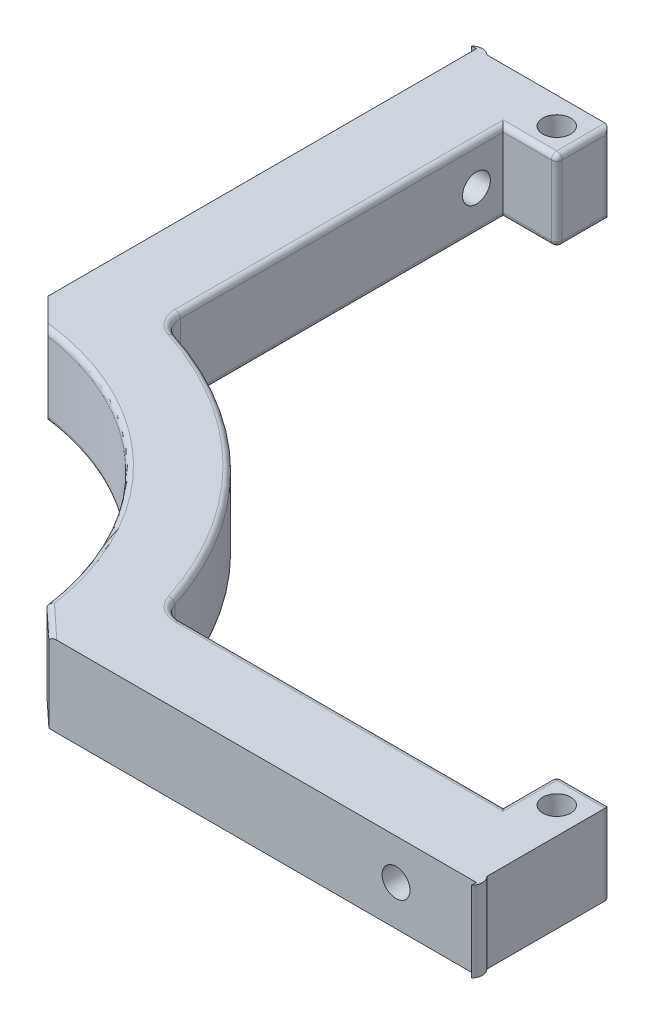
from build123d import *

# Parameters (mm, degrees)
SKETCH1_R           = 3.302
BOSS_EXTRUDE1_DEPTH = 19.05
CHAMFER1_SIZE       = 6.593417442
CHAMFER1_SIZE_2     = 6.35
FILLET1_R           = 5.08
FILLET2_R           = 1.27
CUT_EXTRUDE3_REACH  = 234.345
SKETCH4_R           = 3.302
CUT_EXTRUDE4_REACH  = 235.383
SKETCH5_R           = 3.302
FILLET27_R          = 2.54


with BuildPart() as part:
    # Sketch1 → Boss-Extrude1 (new body)
    with BuildSketch(Plane(origin=(0, 0, 0), x_dir=(1, 0, 0), z_dir=(0, 1, 0))):
        with BuildLine():
            Line((0, 0), (0, -107.95))
            ThreePointArc((0, -107.95), (44.047088178, -127.137896363), (63.234984541, -171.184984541))
            Line((63.234984541, -171.184984541), (171.184984541, -171.184984541))
            Line((171.184984541, -171.184984541), (171.184984541, -172.327984541))
            Line((171.184984541, -172.327984541), (173.724984541, -172.327984541))
            Line((173.724984541, -172.327984541), (171.184984541, -168.644984541))
            Line((171.184984541, -168.644984541), (171.184984541, -139.434984541))
            Line((171.184984541, -139.434984541), (158.484984541, -139.434984541))
            Line((158.484984541, -139.434984541), (158.484984541, -152.134984541))
            Line((158.484984541, -152.134984541), (78.172986392, -152.134984541))
            ThreePointArc((78.172986392, -152.134984541), (56.455029962, -114.729954579), (19.05, -93.011998149))
            Line((19.05, -93.011998149), (19.05, -12.7))
            Line((19.05, -12.7), (31.75, -12.7))
            Line((31.75, -12.7), (31.75, 0))
            Line((31.75, 0), (2.54, 0))
            Line((2.54, 0), (-1.143, 2.54))
            Line((-1.143, 2.54), (-1.143, 0))
            Line((-1.143, 0), (0, 0))
        make_face()
        with Locations(Location((25.4, -6.35, 0), (0, 0, 90))):
            Circle(SKETCH1_R, mode=Mode.SUBTRACT)
        with Locations(Location((164.834984541, -145.784984541, 0), (0, 0, 90))):
            Circle(SKETCH1_R, mode=Mode.SUBTRACT)
    extrude(amount=BOSS_EXTRUDE1_DEPTH)

    # Chamfer1
    # the kernel refuses this chamfer: 6.593417442, 6.35 mm, written as the material it takes off along each edge
    with BuildSketch(Plane(origin=(63.234984541, -17.246656522, 171.184984541), x_dir=(-0.08720585159632499, 0, -0.9961903128656491), z_dir=(0, 1, 0))) as chamfer1_piece_1:
        with BuildLine():
            Line((6.700635555, 0), (-CHAMFER1_SIZE * 0.0872058515927, -CHAMFER1_SIZE * 0.996190312824))
            Line((-CHAMFER1_SIZE * 0.0872058515927, -CHAMFER1_SIZE * 0.996190312824), (0, 0))
            ThreePointArc((0, 0), (3.448459053, -0.085459063), (6.700635555, 0))
        make_face()
    extrude(amount=53.543313044, mode=Mode.SUBTRACT)
    with BuildSketch(Plane(origin=(0, -18.02411909, 107.95), x_dir=(0, 0, -1), z_dir=(0, 1, 0))) as chamfer1_piece_2:
        with BuildLine():
            Line((CHAMFER1_SIZE_2, 0), (-0.627104296, -6.977104296))
            ThreePointArc((-0.627104296, -6.977104296), (-0.229600221, -3.597999822), (0, 0))
            Line((0, 0), (CHAMFER1_SIZE_2, 0))
        make_face()
    extrude(amount=55.098238181, mode=Mode.SUBTRACT)

    # Fillet1
    fillet1_edges = [part.edges().sort_by_distance(p)[0] for p in [
        (19.05, 9.525, 93.011998149),
        (78.172986392, 9.525, 152.134984541),
    ]]
    fillet(fillet1_edges, radius=FILLET1_R)

    # Fillet2
    fillet2_edges = [part.edges().sort_by_distance(p)[0] for p in [
        (31.75, 0, 6.35),
        (25.4, 0, 12.7),
        (120.223999201, 0, 152.134984541),
        (158.484984541, 0, 145.784984541),
        (164.834984541, 0, 139.434984541),
        (31.75, 9.525, 0),
        (31.75, 9.525, 12.7),
        (158.484984541, 9.525, 139.434984541),
        (171.184984541, 9.525, 139.434984541),
        (164.834984541, 19.05, 139.434984541),
        (158.484984541, 19.05, 145.784984541),
        (120.223999201, 19.05, 152.134984541),
        (44.154800127, 0, 127.245858784),
        (44.154800127, 19.05, 127.245858784),
        (25.4, 19.05, 12.7),
        (66.239525947, 19.05, 167.847430426),
        (31.75, 19.05, 6.35),
        (56.455029962, 0, 114.729954579),
        (56.455029962, 19.05, 114.729954579),
        (19.05, 0, 50.96098534),
        (19.05, 19.05, 50.96098534),
        (78.969227792, 0, 151.159085536),
        (78.969227792, 19.05, 151.159085536),
        (20.025899005, 0, 92.215756749),
        (20.025899005, 19.05, 92.215756749),
    ]]
    fillet(fillet2_edges, radius=FILLET2_R)

    # Sketch4 → Cut-Extrude3 (cut, up to next)
    with BuildSketch(Plane(origin=(19.05, 0, 0), x_dir=(0, 0, -1), z_dir=(1, 0, 0)), mode=Mode.PRIVATE) as cut_extrude3_sk1:
        with Locations((-19.05, 9.525)):
            Circle(SKETCH4_R)
    cut_extrude3_tool1 = extrude(cut_extrude3_sk1.sketch, amount=-CUT_EXTRUDE3_REACH, mode=Mode.PRIVATE) & part.part
    add(cut_extrude3_tool1.solids().sort_by_distance((19.05, 9.525, 19.05))[0], mode=Mode.SUBTRACT)

    # Sketch5 → Cut-Extrude4 (cut, up to next)
    with BuildSketch(Plane(origin=(0, 0, 152.134984541), x_dir=(-1, 0, 0), z_dir=(0, 0, -1)), mode=Mode.PRIVATE) as cut_extrude4_sk1:
        with Locations((-152.134984541, 9.525)):
            Circle(SKETCH5_R)
    cut_extrude4_tool1 = extrude(cut_extrude4_sk1.sketch, amount=-CUT_EXTRUDE4_REACH, mode=Mode.PRIVATE) & part.part
    add(cut_extrude4_tool1.solids().sort_by_distance((152.134985, 9.525, 152.134985))[0], mode=Mode.SUBTRACT)

    # Fillet27
    # the kernel refuses this fillet: 2.54 mm, written as the material it takes off along each edge
    with BuildSketch(Plane(origin=(-1.143, -9.855086022, -2.54), x_dir=(0, 0, 1), z_dir=(0, 1, 0))) as fillet27_piece_1:
        with BuildLine():
            CenterArc((4.328983323, 1.80309142), FILLET27_R, 145.407711312, 79.817320271)
            Line((2.238022847, 3.245133128), (0, 0))
            Line((0, 0), (2.54, 0))
        make_face()
    extrude(amount=38.760172045, mode=Mode.SUBTRACT)
    with BuildSketch(Plane(origin=(173.724984541, -9.855086022, 172.327984541), x_dir=(-0.5677329558036515, 0, -0.8232127859153119), z_dir=(0, 1, 0))) as fillet27_piece_2:
        with BuildLine():
            CenterArc((3.942034409, 2.54), FILLET27_R, 190.182679729, 79.817320271)
            Line((1.442041708, 2.090960476), (0, 0))
            Line((0, 0), (3.942034409, 0))
        make_face()
    extrude(amount=38.760172045, mode=Mode.SUBTRACT)


solid = part.part
